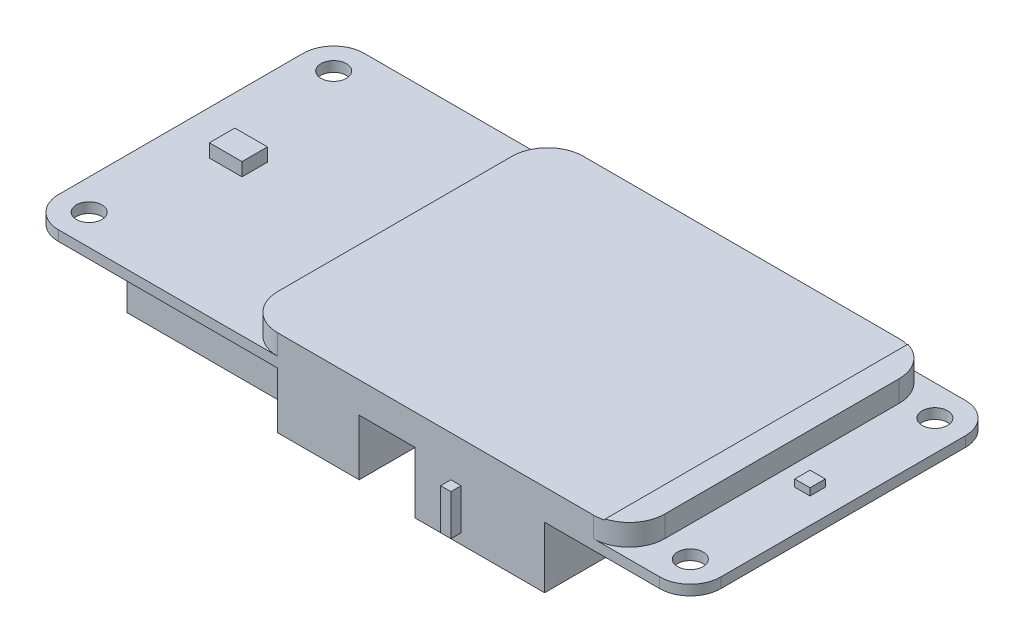
from build123d import *

# Parameters (mm, degrees)
SKETCH_1_R         = 1.25
BOARD_DEPTH        = 1
SKETCH_2_W         = 38
SKETCH_2_H         = 30
SCREEN_DEPTH       = 2
SCREEN_RADIUS_R    = 3.5
SCREEN_TOP_START   = 0.1
SCREEN_TOP_DEPTH   = 0.1
SKETCH_3_W         = 51
SKETCH_3_H         = 5
PLUG_DEPTH         = 5.2
SKETCH_4_W         = 15.14
SKETCH_4_H         = 20
SPEAKER_DEPTH      = 5
SKETCH_10_W        = 8
SKETCH_10_H        = 6
SPEAKER2PLUG_DEPTH = 5.5
SKETCH_5_W         = 12.7
SKETCH_5_H         = 6
BUTTON_DEPTH       = 6
SKETCH_6_W         = 1
SKETCH_6_H         = 4
BUTTON_TAP_DEPTH   = 1
SKETCH_7_W         = 1.5
SKETCH_7_H         = 1.5
RGB_LED_DEPTH      = 0.7
SKETCH_8_W         = 3.2
SKETCH_8_H         = 2.5
MIC_DEPTH          = 1.3


with BuildPart() as part:
    # 草图1 → board (new body)
    with BuildSketch(Plane(origin=(0, 0, 0), x_dir=(1, 0, 0), z_dir=(0, 1, 0))):
        with BuildLine():
            Line((-29.5, 15), (29.5, 15))
            ThreePointArc((29.5, 15), (31.621320344, 14.121320344), (32.5, 12))
            Line((32.5, 12), (32.5, -12))
            ThreePointArc((32.5, -12), (31.621320344, -14.121320344), (29.5, -15))
            Line((29.5, -15), (-29.5, -15))
            ThreePointArc((-29.5, -15), (-31.621320344, -14.121320344), (-32.5, -12))
            Line((-32.5, -12), (-32.5, 12))
            ThreePointArc((-32.5, 12), (-31.621320344, 14.121320344), (-29.5, 15))
        make_face()
        with Locations((-29.5, 12)):
            Circle(SKETCH_1_R, mode=Mode.SUBTRACT)
        with Locations((29.5, 12)):
            Circle(SKETCH_1_R, mode=Mode.SUBTRACT)
        with Locations((-29.5, -12)):
            Circle(SKETCH_1_R, mode=Mode.SUBTRACT)
        with Locations((29.5, -12)):
            Circle(SKETCH_1_R, mode=Mode.SUBTRACT)
    extrude(amount=BOARD_DEPTH)

    # 草图2 → screen (add)
    with BuildSketch(Plane(origin=(0, 1, 0), x_dir=(1, 0, 0), z_dir=(0, 1, 0))):
        with Locations((7.5, 0)):
            Rectangle(SKETCH_2_W, SKETCH_2_H)
    extrude(amount=SCREEN_DEPTH)

    # screen-radius
    screen_radius_edges = [part.edges().sort_by_distance(p)[0] for p in [
        (-11.5, 2, -15),
        (26.5, 2, -15),
        (26.5, 2, 15),
        (-11.5, 2, 15),
    ]]
    fillet(screen_radius_edges, radius=SCREEN_RADIUS_R)

    # 草图9 → screen-top (add)
    with BuildSketch(Plane(origin=(0, 3, 0), x_dir=(1, 0, 0), z_dir=(0, 1, 0)).offset(SCREEN_TOP_START)):
        with BuildLine():
            Line((26.5, -11.5), (26.5, 11.5))
            ThreePointArc((26.5, 11.5), (25.80624304, 13.591650066), (24, 14.854101966))
            Line((24, 14.854101966), (24, -14.854101966))
            ThreePointArc((24, -14.854101966), (25.80624304, -13.591650066), (26.5, -11.5))
        make_face()
    extrude(amount=-SCREEN_TOP_DEPTH)

    # 草图3 → plug (add)
    with BuildSketch(Plane.XZ):
        with Locations((0, -11.5)):
            Rectangle(SKETCH_3_W, SKETCH_3_H)
    extrude(amount=PLUG_DEPTH)

    # 草图4 → speaker (add)
    with BuildSketch(Plane.XZ):
        with Locations((-17.52, 2.68)):
            Rectangle(SKETCH_4_W, SKETCH_4_H)
    extrude(amount=SPEAKER_DEPTH)

    # 草图10 → speaker2plug (add)
    with BuildSketch(Plane.XZ):
        with Locations((-4, 12)):
            Rectangle(SKETCH_10_W, SKETCH_10_H)
    extrude(amount=SPEAKER2PLUG_DEPTH)

    # 草图5 → button (add)
    with BuildSketch(Plane.XZ):
        with Locations((11.85, 12)):
            Rectangle(SKETCH_5_W, SKETCH_5_H)
    extrude(amount=BUTTON_DEPTH)

    # 草图6 → button-tap (add)
    with BuildSketch(Plane.XY.offset(15)):
        with Locations((9.5, -3)):
            Rectangle(SKETCH_6_W, SKETCH_6_H)
    extrude(amount=BUTTON_TAP_DEPTH)

    # 草图7 → rgb-led (add)
    with BuildSketch(Plane(origin=(0, 1, 0), x_dir=(1, 0, 0), z_dir=(0, 1, 0))):
        with Locations((29.25, 0)):
            Rectangle(SKETCH_7_W, SKETCH_7_H)
    extrude(amount=RGB_LED_DEPTH)

    # 草图8 → mic (add)
    with BuildSketch(Plane(origin=(0, 1, 0), x_dir=(1, 0, 0), z_dir=(0, 1, 0))):
        with Locations((-26.6, -0.25)):
            Rectangle(SKETCH_8_W, SKETCH_8_H)
    extrude(amount=MIC_DEPTH)


solid = part.part
